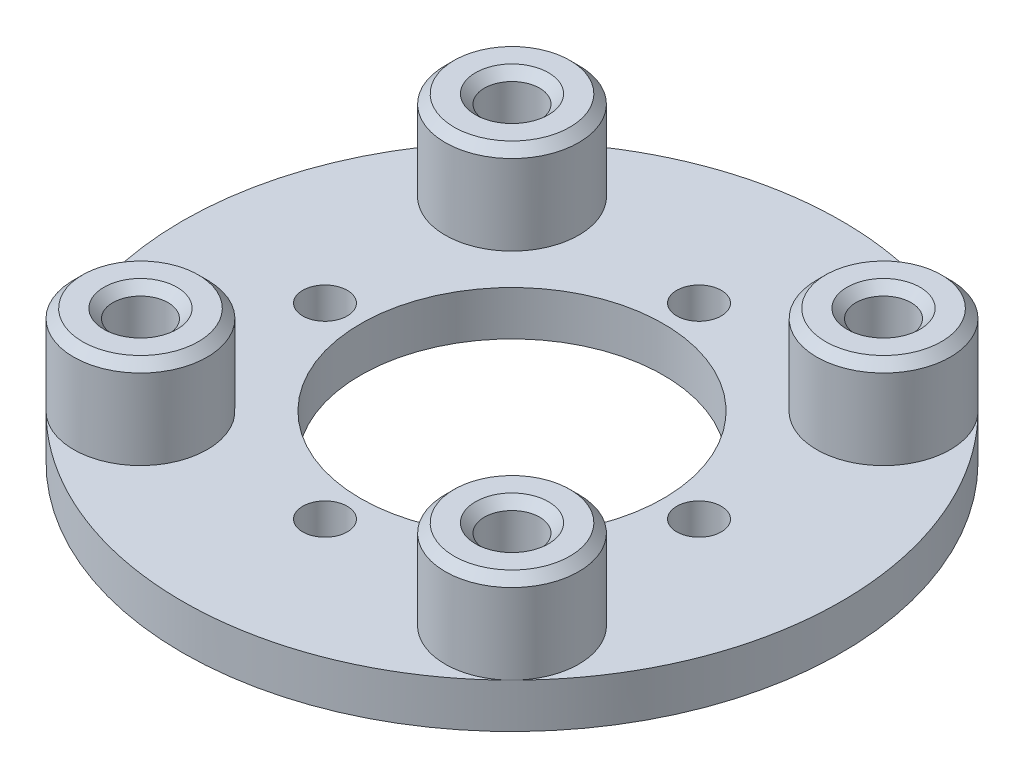
from build123d import *

# Parameters (mm, degrees)
SKETCH_1_R          = 37
SKETCH_1_R_2        = 2.5
SKETCH_1_R_3        = 17
EXTRUDE_1_DEPTH     = 5
SKETCH_4_R          = 7.5
EXTRUDE_9_DEPTH     = 10
CUT_EXTRUDE_1_REACH = 56.433
SKETCH_2_R          = 3.1
CHAMFER_1_SIZE      = 1


with BuildPart() as part:
    # 草图1 → 凸台-拉伸1 (new body)
    with BuildSketch(Plane(origin=(0, 0, 0), x_dir=(1, 0, 0), z_dir=(0, 1, 0))):
        Circle(SKETCH_1_R)
        with Locations((21, 0)):
            Circle(SKETCH_1_R_2, mode=Mode.SUBTRACT)
        with Locations((0, -21)):
            Circle(SKETCH_1_R_2, mode=Mode.SUBTRACT)
        with Locations((-21, 0)):
            Circle(SKETCH_1_R_2, mode=Mode.SUBTRACT)
        with Locations((0, 21)):
            Circle(SKETCH_1_R_2, mode=Mode.SUBTRACT)
        Circle(SKETCH_1_R_3, mode=Mode.SUBTRACT)
    extrude(amount=EXTRUDE_1_DEPTH)

    # 草图4 → 凸台-拉伸9 (add)
    with BuildSketch(Plane(origin=(0, 5, 0), x_dir=(1, 0, 0), z_dir=(0, 1, 0))):
        with Locations((20.859650045, -20.859650045)):
            Circle(SKETCH_4_R)
        with Locations((-20.859650045, -20.859650045)):
            Circle(SKETCH_4_R)
        with Locations((-20.859650045, 20.859650045)):
            Circle(SKETCH_4_R)
        with Locations((20.859650045, 20.859650045)):
            Circle(SKETCH_4_R)
    extrude(amount=EXTRUDE_9_DEPTH)

    # 草图2 → 切除-拉伸1 (cut, up to next)
    with BuildSketch(Plane.XZ, mode=Mode.PRIVATE) as cut_extrude_1_sk1:
        with Locations((20.859650045, 20.859650045)):
            Circle(SKETCH_2_R)
    cut_extrude_1_tool1 = extrude(cut_extrude_1_sk1.sketch, amount=-CUT_EXTRUDE_1_REACH, mode=Mode.PRIVATE) & part.part
    # 草图2 → 切除-拉伸1 (cut, up to next)
    with BuildSketch(Plane.XZ, mode=Mode.PRIVATE) as cut_extrude_1_sk2:
        with Locations((20.859650045, -20.859650045)):
            Circle(SKETCH_2_R)
    cut_extrude_1_tool2 = extrude(cut_extrude_1_sk2.sketch, amount=-CUT_EXTRUDE_1_REACH, mode=Mode.PRIVATE) & part.part
    # 草图2 → 切除-拉伸1 (cut, up to next)
    with BuildSketch(Plane.XZ, mode=Mode.PRIVATE) as cut_extrude_1_sk3:
        with Locations((-20.859650045, -20.859650045)):
            Circle(SKETCH_2_R)
    cut_extrude_1_tool3 = extrude(cut_extrude_1_sk3.sketch, amount=-CUT_EXTRUDE_1_REACH, mode=Mode.PRIVATE) & part.part
    # 草图2 → 切除-拉伸1 (cut, up to next)
    with BuildSketch(Plane.XZ, mode=Mode.PRIVATE) as cut_extrude_1_sk4:
        with Locations((-20.859650045, 20.859650045)):
            Circle(SKETCH_2_R)
    cut_extrude_1_tool4 = extrude(cut_extrude_1_sk4.sketch, amount=-CUT_EXTRUDE_1_REACH, mode=Mode.PRIVATE) & part.part
    add(cut_extrude_1_tool1.solids().sort_by_distance((20.85965, 0, 20.85965))[0], mode=Mode.SUBTRACT)
    add(cut_extrude_1_tool2.solids().sort_by_distance((20.85965, 0, -20.85965))[0], mode=Mode.SUBTRACT)
    add(cut_extrude_1_tool3.solids().sort_by_distance((-20.85965, 0, -20.85965))[0], mode=Mode.SUBTRACT)
    add(cut_extrude_1_tool4.solids().sort_by_distance((-20.85965, 0, 20.85965))[0], mode=Mode.SUBTRACT)

    # 倒角1
    chamfer_1_edges = [part.edges().sort_by_distance(p)[0] for p in [
        (17.759650045, 0, -20.859650045),
        (-23.959650045, 0, -20.859650045),
        (-23.959650045, 0, 20.859650045),
        (17.759650045, 0, 20.859650045),
        (17.759650045, 15, -20.859650045),
        (-23.959650045, 15, -20.859650045),
        (-23.959650045, 15, 20.859650045),
        (17.759650045, 15, 20.859650045),
        (13.359650045, 15, 20.859650045),
        (13.359650045, 15, -20.859650045),
        (-28.359650045, 15, -20.859650045),
        (-28.359650045, 15, 20.859650045),
    ]]
    chamfer(chamfer_1_edges, length=CHAMFER_1_SIZE)


solid = part.part
